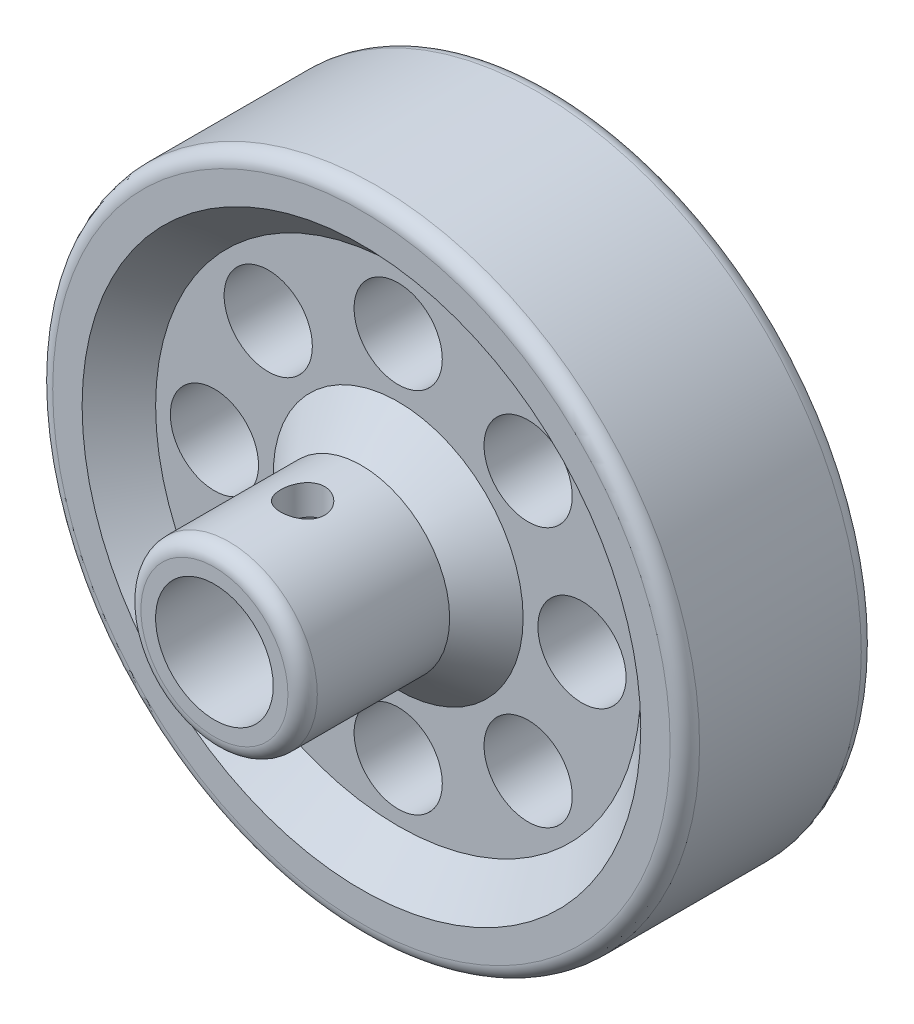
from build123d import *

# Parameters (mm, degrees)
SKETCH1_R           = 22
SKETCH1_R_2         = 19
BOSS_EXTRUDE1_DEPTH = 6.5
SKETCH2_R           = 19
BOSS_EXTRUDE2_DEPTH = 4
CHAMFER1_SIZE       = 2.5
SKETCH3_R           = 3
CUT_EXTRUDE1_DEPTH  = 4
SKETCH5_R           = 8.5
BOSS_EXTRUDE3_DEPTH = 6.5
CHAMFER3_SIZE       = 2.5
SKETCH6_R           = 6
BOSS_EXTRUDE4_DEPTH = 10
FILLET2_R           = 1
SKETCH7_R           = 4
CUT_EXTRUDE2_DEPTH  = 23
SKETCH8_R           = 1.5
CUT_EXTRUDE3_DEPTH  = 6.5
FILLET3_R           = 1


with BuildPart() as part:
    # Sketch1 → Boss-Extrude1 (new, symmetric)
    with BuildSketch(Plane.XY):
        with Locations(Location((0, 0, 0), (0, 0, 180))):
            Circle(SKETCH1_R)
        with Locations(Location((0, 0, 0), (0, 0, 180))):
            Circle(SKETCH1_R_2, mode=Mode.SUBTRACT)
    extrude(amount=BOSS_EXTRUDE1_DEPTH, both=True)

    # Sketch2 → Boss-Extrude2 (add, symmetric)
    with BuildSketch(Plane.XY):
        with Locations(Location((0, 0, 0), (0, 0, 180))):
            Circle(SKETCH2_R)
    extrude(amount=BOSS_EXTRUDE2_DEPTH, both=True)

    # Chamfer1
    chamfer1_edges = [part.edges().sort_by_distance(p)[0] for p in [
        (19, 0, -4),
        (19, 0, 4),
    ]]
    chamfer(chamfer1_edges, length=CHAMFER1_SIZE - 0.0001)  # a hair under: the kernel refuses the full size

    # Sketch3 → Cut-Extrude1 (cut, symmetric)
    with BuildSketch(Plane.XY):
        with Locations((0, 12.5)):
            Circle(SKETCH3_R)
        with Locations((8.838834765, 8.838834765)):
            Circle(SKETCH3_R)
        with Locations((12.5, 0)):
            Circle(SKETCH3_R)
        with Locations((8.838834765, -8.838834765)):
            Circle(SKETCH3_R)
        with Locations((0, -12.5)):
            Circle(SKETCH3_R)
        with Locations((-8.838834765, -8.838834765)):
            Circle(SKETCH3_R)
        with Locations((-12.5, 0)):
            Circle(SKETCH3_R)
        with Locations((-8.838834765, 8.838834765)):
            Circle(SKETCH3_R)
    extrude(amount=CUT_EXTRUDE1_DEPTH, both=True, mode=Mode.SUBTRACT)

    # Sketch5 → Boss-Extrude3 (add, symmetric)
    with BuildSketch(Plane.XY):
        with Locations(Location((0, 0, 0), (0, 0, 180))):
            Circle(SKETCH5_R)
    extrude(amount=BOSS_EXTRUDE3_DEPTH, both=True)

    # Chamfer3
    chamfer3_edges = [part.edges().sort_by_distance(p)[0] for p in [
        (8.5, 0, -6.5),
        (8.5, 0, 6.5),
    ]]
    chamfer(chamfer3_edges, length=CHAMFER3_SIZE - 0.0001)  # a hair under: the kernel refuses the full size

    # Sketch6 → Boss-Extrude4 (add)
    with BuildSketch(Plane.XY.offset(6.5)):
        Circle(SKETCH6_R)
    extrude(amount=BOSS_EXTRUDE4_DEPTH)

    # Fillet2
    fillet2_edges = [part.edges().sort_by_distance(p)[0] for p in [
        (-6, 0, 16.5),
    ]]
    fillet(fillet2_edges, radius=FILLET2_R)

    # Sketch7 → Cut-Extrude2 (cut)
    with BuildSketch(Plane.XY.offset(16.5)):
        Circle(SKETCH7_R)
    extrude(amount=-CUT_EXTRUDE2_DEPTH, mode=Mode.SUBTRACT)

    # Sketch8 → Cut-Extrude3 (cut, symmetric)
    with BuildSketch(Plane(origin=(0, 0, 0), x_dir=(1, 0, 0), z_dir=(0, 1, 0))):
        with Locations(Location((0, -10.5, 0), (0, 0, 270))):
            Circle(SKETCH8_R)
    extrude(amount=CUT_EXTRUDE3_DEPTH, both=True, mode=Mode.SUBTRACT)

    # Fillet3
    fillet3_edges = [part.edges().sort_by_distance(p)[0] for p in [
        (22, 0, -6.5),
        (22, 0, 6.5),
    ]]
    fillet(fillet3_edges, radius=FILLET3_R)


solid = part.part
